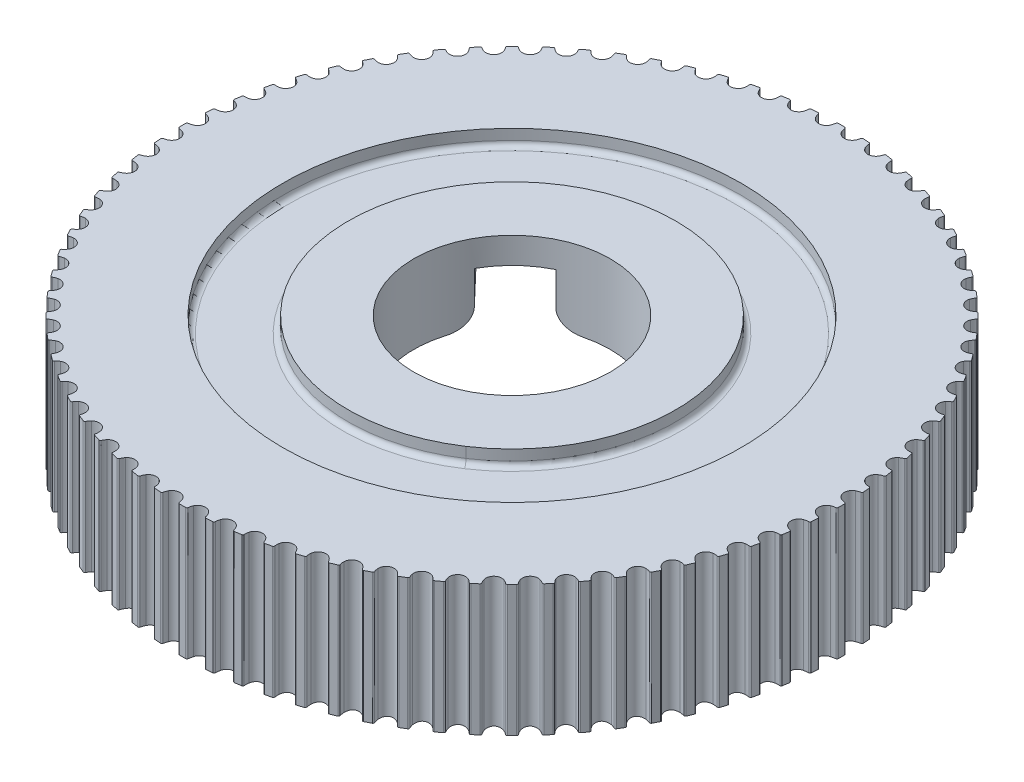
from build123d import *

# Parameters (mm, degrees)
SKETCH4_R           = 21.6
BOSS_EXTRUDE1_DEPTH = 4
FILLET1_R           = 1.5
SKETCH5_R           = 21.6
BOSS_EXTRUDE2_DEPTH = 2
CUT_EXTRUDE1_START  = 2
SKETCH5_4_R         = 17.5
SKETCH5_4_R_2       = 12.5
CUT_EXTRUDE1_DEPTH  = 1.2
FILLET2_R           = 0.4
CUT_EXTRUDE3_DEPTH  = 38.035016702
CIRPATTERN2_COUNT   = 80
SKETCH9_R           = 7.5
CUT_EXTRUDE4_DEPTH  = 37.966930345


with BuildPart() as part:
    # Sketch4 → Boss-Extrude1 (new body)
    with BuildSketch(Plane(origin=(0, 10, 0), x_dir=(1, 0, 0), z_dir=(0, 1, 0))):
        with Locations(Location((0, 0, 0), (0, 0, 270))):
            Circle(SKETCH4_R)
        with BuildLine():
            ThreePointArc((-6.542299927, 3.667193977), (-5.424949595, -5.17879541), (3.359662831, -6.705420618))
            Line((3.359662831, -6.705420618), (9.874491438, -13.529906626))
            ThreePointArc((9.874491438, -13.529906626), (12.984923306, -13.602111853), (13.057128534, -10.491679985))
            Line((13.057128534, -10.491679985), (6.542299927, -3.667193977))
            ThreePointArc((6.542299927, -3.667193977), (5.424949595, 5.17879541), (-3.359662831, 6.705420618))
            Line((-3.359662831, 6.705420618), (-9.874491438, 13.529906626))
            ThreePointArc((-9.874491438, 13.529906626), (-12.984923306, 13.602111853), (-13.057128534, 10.491679985))
            Line((-13.057128534, 10.491679985), (-6.542299927, 3.667193977))
        make_face(mode=Mode.SUBTRACT)
    extrude(amount=BOSS_EXTRUDE1_DEPTH)

    # Fillet1
    fillet1_edges = [part.edges().sort_by_distance(p)[0] for p in [
        (6.617077135, 10, 10.117663622),
        (12.984923306, 10, 13.602111853),
        (9.79971423, 10, 7.079436981),
        (-6.617077135, 10, -10.117663622),
        (-12.984923306, 10, -13.602111853),
        (-9.79971423, 10, -7.079436981),
    ]]
    fillet(fillet1_edges, radius=FILLET1_R)

    # Sketch5 → Boss-Extrude2 (add)
    with BuildSketch(Plane(origin=(0, 14, 0), x_dir=(1, 0, 0), z_dir=(0, 1, 0))):
        with Locations(Location((0, 0, 0), (0, 0, 270))):
            Circle(SKETCH5_R)
    extrude(amount=BOSS_EXTRUDE2_DEPTH)

    # Sketch5<4> → Cut-Extrude1 (cut)
    with BuildSketch(Plane(origin=(0, 14, 0), x_dir=(1, 0, 0), z_dir=(0, 1, 0)).offset(CUT_EXTRUDE1_START)):
        with Locations(Location((0, 0, 0), (0, 0, 270))):
            Circle(SKETCH5_4_R)
        Circle(SKETCH5_4_R_2, mode=Mode.SUBTRACT)
    extrude(amount=-CUT_EXTRUDE1_DEPTH, mode=Mode.SUBTRACT)

    # Fillet2
    fillet2_edges = [part.edges().sort_by_distance(p)[0] for p in [
        (-12.5, 14.8, 0),
        (-12.5, 14.8, 0),
        (0, 14.8, -17.5),
    ]]
    fillet(fillet2_edges, radius=FILLET2_R)

    # Sketch6 → Revolve2 (revolve)
    with BuildSketch(Plane(origin=(0, 0, 0), x_dir=(0, 0, -1), z_dir=(1, 0, 0)), mode=Mode.PRIVATE) as revolve2_sk:
        with BuildLine():
            Line((21.6, 10), (22.024107439, 10))
            add(Edge.make_bspline(
                [(22.024107439, 10), (22.071999402, 10), (23.029838659, 10), (23.338929475, 8.872952918), (23.662546217, 6.794666489), (24.145065316, 6), (25.164050729, 6), (25.215, 6)],
                knots=[0, 0, 0, 0, 0.013646434, 0.272928683, 0.716861024, 0.985843051, 1, 1, 1, 1], degree=3))
            Line((25.215, 6), (25.215, 16))
            Line((25.215, 16), (21.6, 16))
            Line((21.6, 16), (21.6, 10))
        make_face()
    revolve(revolve2_sk.sketch.rotate(Axis((0, 16, 0), (0, -1, 0)), 180), axis=Axis((0, 16, 0), (0, -1, 0)))

    # Sketch8 → Cut-Extrude3 (cut, through all)
    with BuildSketch(Plane(origin=(0, 16, 0), x_dir=(1, 0, 0), z_dir=(0, 1, 0))):
        with BuildLine():
            ThreePointArc((25.213795959, -0.246410943), (25.214698988, -0.123206942), (25.215, 0))
            ThreePointArc((25.215, 0), (25.214698988, 0.123206942), (25.213795959, 0.246410943))
            ThreePointArc((25.213795959, 0.246410943), (25.211380164, 0.271796834), (25.204699199, 0.296406675))
            Line((25.204699199, 0.296406675), (25.163309726, 0.295919936))
            Line((25.163309726, 0.295919936), (25.163798346, 0.245922323))
            ThreePointArc((25.163798346, 0.245922323), (25.165, 0), (25.163798346, -0.245922323))
            ThreePointArc((25.163798346, -0.245922323), (25.137574197, -0.312456774), (25.073619542, -0.344462107))
            ThreePointArc((25.073619542, -0.344462107), (24.911627868, -0.373398218), (24.756146457, -0.427288215))
            ThreePointArc((24.756146457, -0.427288215), (24.393627755, -0.958331316), (24.713368198, -1.516177741))
            ThreePointArc((24.713368198, -1.516177741), (24.864142674, -1.582099347), (25.023365011, -1.623654715))
            ThreePointArc((25.023365011, -1.623654715), (25.084611698, -1.660578724), (25.105535317, -1.728965429))
            Line((25.105535317, -1.728965429), (25.102100059, -1.778847279))
            Line((25.102100059, -1.778847279), (25.151925437, -1.782378128))
            ThreePointArc((25.151925437, -1.782378128), (25.153683715, -1.757390275), (25.155417167, -1.732400687))
            ThreePointArc((25.155417167, -1.732400687), (25.124031739, -1.62982063), (25.032161708, -1.574434616))
            ThreePointArc((25.032161708, -1.574434616), (24.880521388, -1.534858076), (24.736926648, -1.472075593))
            ThreePointArc((24.736926648, -1.472075593), (24.443589215, -0.960294108), (24.776172433, -0.473102626))
            ThreePointArc((24.776172433, -0.473102626), (24.924249968, -0.421778819), (25.078527753, -0.394220618))
            ThreePointArc((25.078527753, -0.394220618), (25.174459735, -0.34621262), (25.213795959, -0.246410943))
        make_face()
        with BuildLine():
            ThreePointArc((25.204699199, 0.296406675), (25.211380164, 0.271796834), (25.213795959, 0.246410943))
            ThreePointArc((25.213795959, 0.246410943), (25.213538722, 0.27145926), (25.213256601, 0.29650731))
            Line((25.213256601, 0.29650731), (25.204699199, 0.296406675))
        make_face()
        with BuildLine():
            Line((25.215, 0), (25.469, 0))
            ThreePointArc((25.469, 0), (25.468559756, 0.149749657), (25.467239039, 0.299494137))
            Line((25.467239039, 0.299494137), (25.213256601, 0.29650731))
            ThreePointArc((25.213256601, 0.29650731), (25.213538722, 0.27145926), (25.213795959, 0.246410943))
            ThreePointArc((25.213795959, 0.246410943), (25.214698988, 0.123206942), (25.215, 0))
        make_face()
        with BuildLine():
            ThreePointArc((25.465336759, -0.431954595), (25.468084173, -0.215985064), (25.469, 0))
            Line((25.469, 0), (25.215, 0))
            ThreePointArc((25.215, 0), (25.214698988, -0.123206942), (25.213795959, -0.246410943))
            ThreePointArc((25.213795959, -0.246410943), (25.21299199, -0.318213657), (25.211983544, -0.390013791))
            ThreePointArc((25.211983544, -0.390013791), (25.340012053, -0.402817716), (25.465336759, -0.431954595))
        make_face()
        with BuildLine():
            ThreePointArc((25.211983544, -0.390013791), (25.21299199, -0.318213657), (25.213795959, -0.246410943))
            ThreePointArc((25.213795959, -0.246410943), (25.174459735, -0.34621262), (25.078527753, -0.394220618))
            ThreePointArc((25.078527753, -0.394220618), (24.924249968, -0.421778819), (24.776172433, -0.473102626))
            ThreePointArc((24.776172433, -0.473102626), (24.443589215, -0.960294108), (24.736926648, -1.472075593))
            ThreePointArc((24.736926648, -1.472075593), (24.880521388, -1.534858076), (25.032161708, -1.574434616))
            ThreePointArc((25.032161708, -1.574434616), (25.124031739, -1.62982063), (25.155417167, -1.732400687))
            ThreePointArc((25.155417167, -1.732400687), (25.160248684, -1.660756199), (25.164876153, -1.589098243))
            ThreePointArc((25.164876153, -1.589098243), (25.167323467, -1.549856288), (25.169709588, -1.510610565))
            ThreePointArc((25.169709588, -1.510610565), (25.18398299, -1.250290261), (25.195564076, -0.989836293))
            ThreePointArc((25.195564076, -0.989836293), (25.204451606, -0.729276506), (25.210644631, -0.468638756))
            ThreePointArc((25.210644631, -0.468638756), (25.211344738, -0.429326795), (25.211983544, -0.390013791))
        make_face()
        with BuildLine():
            ThreePointArc((25.460110991, -0.672836794), (25.463008722, -0.552401874), (25.465336759, -0.431954595))
            ThreePointArc((25.465336759, -0.431954595), (25.340012053, -0.402817716), (25.211983544, -0.390013791))
            ThreePointArc((25.211983544, -0.390013791), (25.211344738, -0.429326795), (25.210644631, -0.468638756))
            ThreePointArc((25.210644631, -0.468638756), (25.350516683, -0.552242792), (25.460110991, -0.672836794))
        make_face()
        with BuildLine():
            ThreePointArc((25.449368291, -0.999807279), (25.455264634, -0.836339285), (25.460110991, -0.672836794))
            ThreePointArc((25.460110991, -0.672836794), (25.350516683, -0.552242792), (25.210644631, -0.468638756))
            ThreePointArc((25.210644631, -0.468638756), (25.204451606, -0.729276506), (25.195564076, -0.989836293))
            Line((25.195564076, -0.989836293), (25.449368291, -0.999807279))
        make_face()
        with BuildLine():
            ThreePointArc((25.434426659, -1.326612805), (25.442422204, -1.163234033), (25.449368291, -0.999807279))
            Line((25.449368291, -0.999807279), (25.195564076, -0.989836293))
            ThreePointArc((25.195564076, -0.989836293), (25.18398299, -1.250290261), (25.169709588, -1.510610565))
            ThreePointArc((25.169709588, -1.510610565), (25.315709383, -1.438237328), (25.434426659, -1.326612805))
        make_face()
        with BuildLine():
            ThreePointArc((25.420738827, -1.567162562), (25.427867197, -1.44690387), (25.434426659, -1.326612805))
            ThreePointArc((25.434426659, -1.326612805), (25.315709383, -1.438237328), (25.169709588, -1.510610565))
            ThreePointArc((25.169709588, -1.510610565), (25.167323467, -1.549856288), (25.164876153, -1.589098243))
            ThreePointArc((25.164876153, -1.589098243), (25.293514555, -1.586377769), (25.420738827, -1.567162562))
        make_face()
        with BuildLine():
            ThreePointArc((25.405290064, -1.800332681), (25.413281868, -1.68376534), (25.420738827, -1.567162562))
            ThreePointArc((25.420738827, -1.567162562), (25.293514555, -1.586377769), (25.164876153, -1.589098243))
            ThreePointArc((25.164876153, -1.589098243), (25.160248684, -1.660756199), (25.155417167, -1.732400687))
            ThreePointArc((25.155417167, -1.732400687), (25.153683715, -1.757390275), (25.151925437, -1.782378128))
            Line((25.151925437, -1.782378128), (25.405290064, -1.800332681))
        make_face()
    cut_extrude3 = extrude(amount=-CUT_EXTRUDE3_DEPTH, mode=Mode.SUBTRACT)

    # CirPattern2: Cut-Extrude3 ×80 about axis
    cirpattern2_axis = Axis((0, 0, 0), (0, 1, 0))
    for i in range(1, CIRPATTERN2_COUNT):
        add(cut_extrude3.rotate(cirpattern2_axis, i * 360 / CIRPATTERN2_COUNT), mode=Mode.SUBTRACT)

    # Sketch9 → Cut-Extrude4 (cut, through all)
    with BuildSketch(Plane(origin=(0, 16, 0), x_dir=(1, 0, 0), z_dir=(0, 1, 0))):
        with Locations(Location((0, 0, 0), (0, 0, 104.110272457))):
            Circle(SKETCH9_R)
    extrude(amount=-CUT_EXTRUDE4_DEPTH, mode=Mode.SUBTRACT)


solid = part.part
